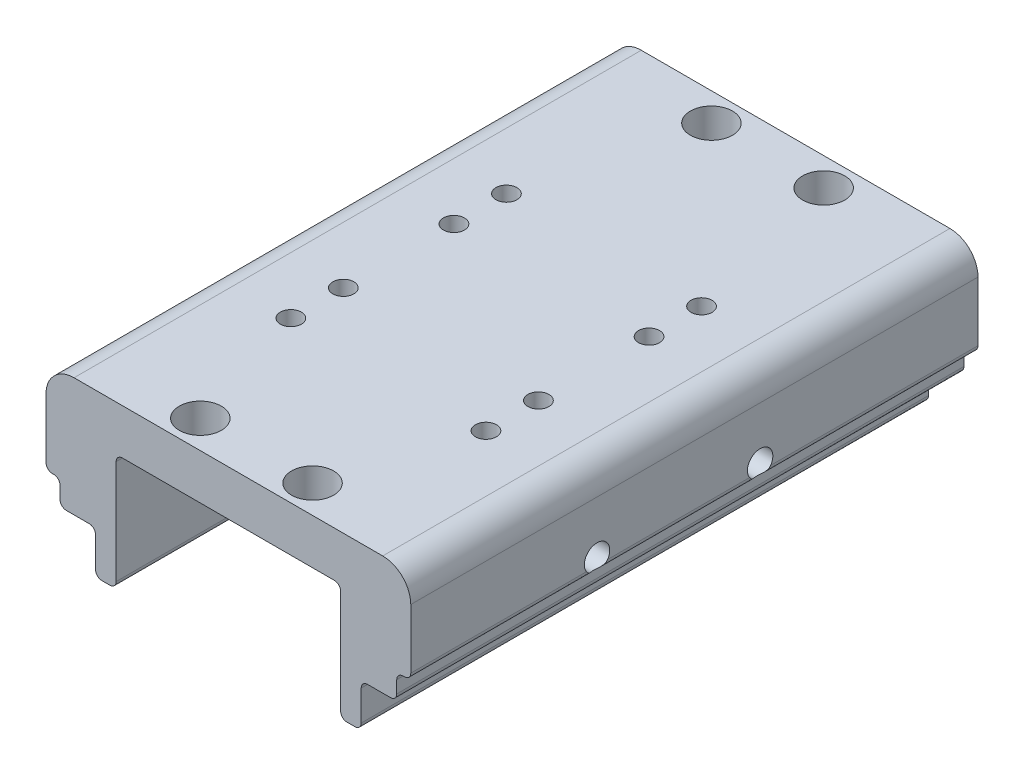
from build123d import *

# Parameters (mm, degrees)
BOSS_EXTRUDE1_DEPTH = 513.461
SKETCH2_R           = 19.05
CUT_EXTRUDE1_DEPTH  = 31.75
SKETCH3_R           = 8.75
CUT_EXTRUDE2_DEPTH  = 31.75
SKETCH4_R           = 11.500000003
CUT_EXTRUDE3_DEPTH  = 499.872
SKETCH5_R           = 9.525
CUT_EXTRUDE4_DEPTH  = 107.442


with BuildPart() as part:
    # Sketch1 → Boss-Extrude1 (new body)
    with BuildSketch(Plane.XY):
        with BuildLine():
            ThreePointArc((-165.1, 5.715), (-163.426115254, 1.673884746), (-159.385, 0))
            Line((-159.385, 0), (-158.115, 0))
            ThreePointArc((-158.115, 0), (-154.073884746, -1.673884746), (-152.4, -5.715))
            Line((-152.4, -5.715), (-152.4, -16.91))
            ThreePointArc((-152.4, -16.91), (-150.726115254, -20.951115254), (-146.685, -22.625))
            Line((-146.685, -22.625), (-125.96, -22.625))
            ThreePointArc((-125.96, -22.625), (-121.918884746, -24.298884746), (-120.245, -28.34))
            Line((-120.245, -28.34), (-120.245, -55.82))
            ThreePointArc((-120.245, -55.82), (-118.571115254, -59.861115254), (-114.53, -61.535))
            Line((-114.53, -61.535), (-107.315, -61.535))
            ThreePointArc((-107.315, -61.535), (-103.273884746, -59.861115254), (-101.6, -55.82))
            Line((-101.6, -55.82), (-101.6, 0))
            Line((-101.6, 0), (-101.6, 38.17350945))
            ThreePointArc((-101.6, 38.17350945), (-99.926115254, 42.214624704), (-95.885, 43.88850945))
            Line((-95.885, 43.88850945), (95.885, 43.88850945))
            ThreePointArc((95.885, 43.88850945), (99.926115254, 42.214624704), (101.6, 38.17350945))
            Line((101.6, 38.17350945), (101.6, 0))
            Line((101.6, 0), (101.6, -55.82))
            ThreePointArc((101.6, -55.82), (103.273884746, -59.861115254), (107.315, -61.535))
            Line((107.315, -61.535), (114.53, -61.535))
            ThreePointArc((114.53, -61.535), (118.571115254, -59.861115254), (120.245, -55.82))
            Line((120.245, -55.82), (120.245, -28.34))
            ThreePointArc((120.245, -28.34), (121.918884746, -24.298884746), (125.96, -22.625))
            Line((125.96, -22.625), (146.685, -22.625))
            ThreePointArc((146.685, -22.625), (150.726115254, -20.951115254), (152.4, -16.91))
            Line((152.4, -16.91), (152.4, -5.715))
            ThreePointArc((152.4, -5.715), (154.073884746, -1.673884746), (158.115, 0))
            Line((158.115, 0), (159.385, 0))
            ThreePointArc((159.385, 0), (163.426115254, 1.673884746), (165.1, 5.715))
            Line((165.1, 5.715), (165.1, 59.52))
            ThreePointArc((165.1, 59.52), (157.660512242, 77.480512242), (139.7, 84.92))
            Line((139.7, 84.92), (-139.7, 84.92))
            ThreePointArc((-139.7, 84.92), (-157.660512242, 77.480512242), (-165.1, 59.52))
            Line((-165.1, 59.52), (-165.1, 5.715))
        make_face()
    extrude(amount=BOSS_EXTRUDE1_DEPTH)

    # Sketch2 → Cut-Extrude1 (cut)
    with BuildSketch(Plane(origin=(0, 84.92, 0), x_dir=(1, 0, 0), z_dir=(0, 1, 0))):
        with Locations((-50.8, -25.4)):
            Circle(SKETCH2_R)
        with Locations((50.8, -25.4)):
            Circle(SKETCH2_R)
        with Locations((50.8, -488.061)):
            Circle(SKETCH2_R)
        with Locations((-50.8, -488.061)):
            Circle(SKETCH2_R)
    extrude(amount=-CUT_EXTRUDE1_DEPTH, mode=Mode.SUBTRACT)

    # Sketch3 → Cut-Extrude2 (cut)
    with BuildSketch(Plane(origin=(0, 53.17, 0), x_dir=(1, 0, 0), z_dir=(0, 1, 0))):
        with Locations((-50.8, -25.4)):
            Circle(SKETCH3_R)
        with Locations((50.8, -25.4)):
            Circle(SKETCH3_R)
        with Locations((50.8, -488.061)):
            Circle(SKETCH3_R)
        with Locations((-50.8, -488.061)):
            Circle(SKETCH3_R)
    extrude(amount=-CUT_EXTRUDE2_DEPTH, mode=Mode.SUBTRACT)

    # Sketch4 → Cut-Extrude3 (cut)
    with BuildSketch(Plane.ZY.offset(165.1)):
        with Locations((344.866041788, 12.13850945)):
            Circle(SKETCH4_R)
        with Locations((197.228541788, 12.13850945)):
            Circle(SKETCH4_R)
    extrude(amount=-CUT_EXTRUDE3_DEPTH, mode=Mode.SUBTRACT)

    # Sketch5 → Cut-Extrude4 (cut)
    with BuildSketch(Plane(origin=(0, 84.92, 0), x_dir=(1, 0, 0), z_dir=(0, 1, 0))):
        with Locations((-88.3, -173.478541788)):
            Circle(SKETCH5_R)
        with Locations((88.3, -173.478541788)):
            Circle(SKETCH5_R)
        with Locations((-88.3, -220.978541788)):
            Circle(SKETCH5_R)
        with Locations((88.3, -220.978541788)):
            Circle(SKETCH5_R)
        with Locations((88.3, -321.116041788)):
            Circle(SKETCH5_R)
        with Locations((88.3, -368.616041788)):
            Circle(SKETCH5_R)
        with Locations((-88.3, -368.616041788)):
            Circle(SKETCH5_R)
        with Locations((-88.3, -321.116041788)):
            Circle(SKETCH5_R)
    extrude(amount=-CUT_EXTRUDE4_DEPTH, mode=Mode.SUBTRACT)


solid = part.part
